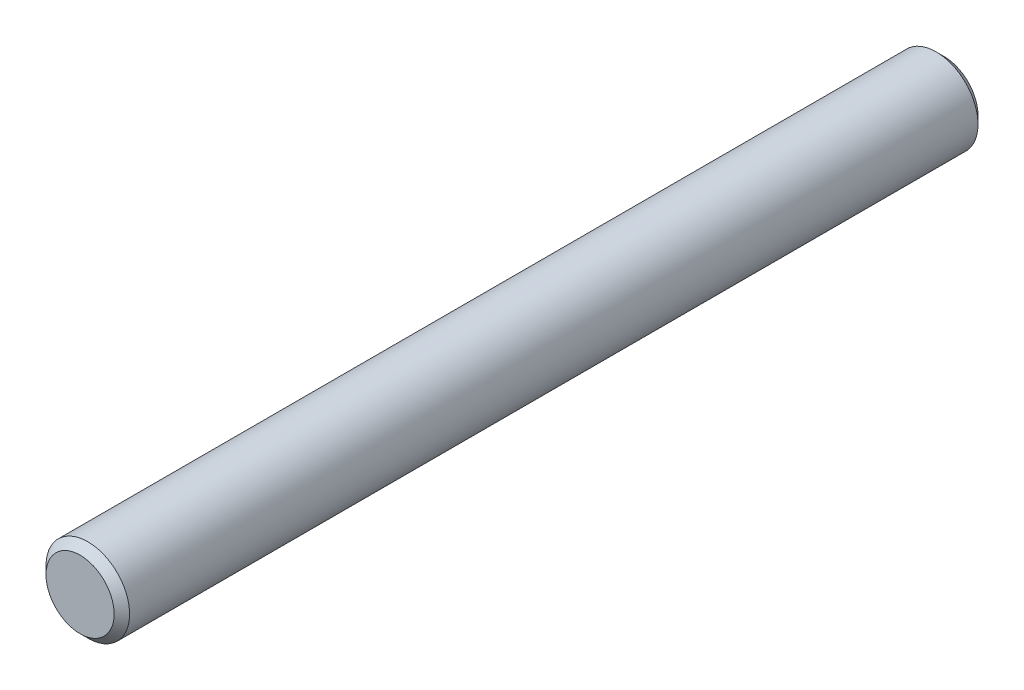
from build123d import *

# Parameters (mm, degrees)
SKETCH1_R           = 3
BOSS_EXTRUDE1_DEPTH = 21


# Read off the part's stored shape, not the designer's step: M6x1.0 Machine Threads Stud1
with BuildPart() as part:
    # Sketch1 → Boss-Extrude1 (new, symmetric)
    with BuildSketch(Plane.XY):
        with Locations(Location((0, 0, 0), (0, 0, 180))):
            Circle(SKETCH1_R)
    extrude(amount=BOSS_EXTRUDE1_DEPTH, both=True)

    # M6x1.0 Machine Threads Stud1 outline → M6x1.0 Machine Threads Stud1 (revolve)
    with BuildSketch(Plane.XZ):
        Polygon((3, 21), (3, 30.4455), (2.4455, 31), (0, 31), (0, 21), align=None)
    m6x1_0_machine_threads_stud1 = revolve(axis=Axis((0, 0, 0), (0, 0, 1)))

    # Mirror1: M6x1.0 Machine Threads Stud1 across plane
    add(m6x1_0_machine_threads_stud1.mirror(Plane.XY))


solid = part.part
